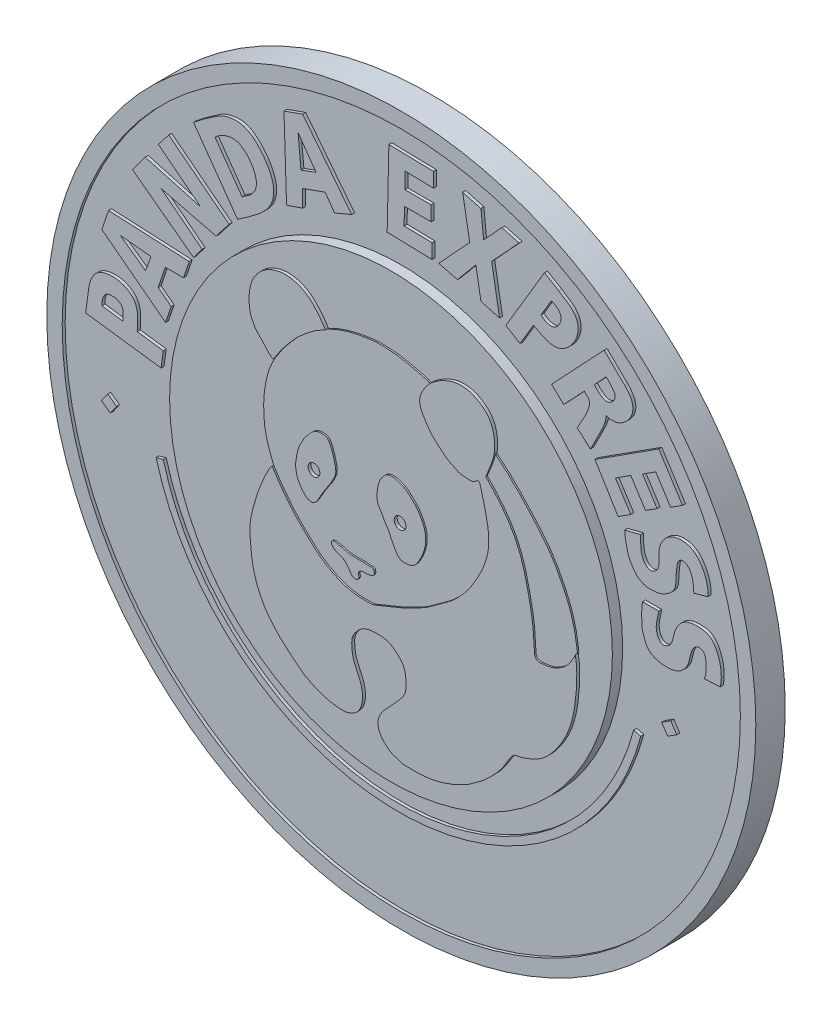
from build123d import *

# Parameters (mm, degrees)
SKETCH1_R             = 24.1
BOSS_EXTRUDE2_DEPTH   = 2
SKETCH1_5_R           = 23.05
CUT_EXTRUDE1_DEPTH    = 0.2
SKETCH1_6_R           = 15.05
BOSS_EXTRUDE3_DEPTH   = 0.7
BOSS_EXTRUDE4_START   = 0.7
BOSS_EXTRUDE4_DEPTH   = 0.2
BOSS_EXTRUDE5_START   = 0.7
BOSS_EXTRUDE5_DEPTH   = 0.1
BOSS_EXTRUDE6_REACH   = 36.141
BOSS_EXTRUDE7_START   = 0.7
SKETCH1_14_R          = 0.4
BOSS_EXTRUDE7_DEPTH   = 0.2
BOSS_EXTRUDE8_START   = 0.7
BOSS_EXTRUDE8_DEPTH   = 0.2
BOSS_EXTRUDE8_2_DEPTH = 0.2
BOSS_EXTRUDE9_DEPTH   = 0.2
BOSS_EXTRUDE11_START  = 0.7
BOSS_EXTRUDE11_DEPTH  = 0.1


with BuildPart() as part:
    # Sketch1 → Boss-Extrude2 (new body)
    with BuildSketch(Plane.XY):
        Circle(SKETCH1_R)
    extrude(amount=-BOSS_EXTRUDE2_DEPTH)

    # Sketch1<5> → Cut-Extrude1 (cut)
    with BuildSketch(Plane.XY):
        Circle(SKETCH1_5_R)
    extrude(amount=-CUT_EXTRUDE1_DEPTH, mode=Mode.SUBTRACT)

    # Sketch1<13> → Boss-Extrude6 (add, up to next)
    with BuildSketch(Plane.XY, mode=Mode.PRIVATE) as boss_extrude6_sk1:
        with BuildLine():
            Line((-21.454558101, 1.493044691), (-16.327953308, 0.809496286))
            Line((-16.327953308, 0.809496286), (-16.181251347, 1.909759225))
            Line((-16.181251347, 1.909759225), (-17.951073862, 2.14573594))
            add(Edge.make_bspline(
                [(-21.30785614, 2.59330763), (-21.269087053, 3.031695072), (-21.176750823, 3.698293171), (-20.549503717, 4.420348184), (-19.73147324, 4.602837812), (-18.826331516, 4.489218381), (-17.78761687, 3.716364728), (-17.916858964, 2.66450519), (-17.951073862, 2.14573594)],
                knots=[0, 0, 0, 0, 0.212608459, 0.302228017, 0.43529493, 0.58816005, 0.727720341, 1, 1, 1, 1], degree=3))
            Line((-21.30785614, 2.59330763), (-21.454558101, 1.493044691))
        make_face()
        with BuildLine():
            add(Edge.make_bspline(
                [(-20.356043735, 2.466399105), (-20.359571573, 2.708030583), (-20.308343626, 3.03611159), (-20.043729464, 3.322452659), (-19.844119656, 3.387377134), (-19.64292089, 3.395677377), (-19.431393119, 3.393138303), (-19.242122229, 3.331483053), (-19.085433999, 3.228302967), (-18.961451063, 3.09953306), (-18.902992442, 2.907938766), (-18.920909953, 2.629344337), (-18.93092145, 2.419013354), (-18.934625232, 2.276876333)],
                knots=[0, 0, 0, 0, 0.249669756, 0.316839939, 0.388223563, 0.457519881, 0.523446875, 0.604010027, 0.657002889, 0.715093793, 0.783365199, 0.854609936, 1, 1, 1, 1], degree=3))
            Line((-18.934625232, 2.276876333), (-20.356043735, 2.466399105))
        make_face(mode=Mode.SUBTRACT)
    boss_extrude6_tool1 = extrude(boss_extrude6_sk1.sketch, amount=-BOSS_EXTRUDE6_REACH, mode=Mode.PRIVATE) - part.part
    # Sketch1<13> → Boss-Extrude6 (add, up to next)
    with BuildSketch(Plane.XY, mode=Mode.PRIVATE) as boss_extrude6_sk2:
        Polygon((-20.356043735, 6.953181357), (-16.025692152, 3.644980448), (-15.640982502, 4.776069205), (-16.529105791, 5.454556901), (-16.041946435, 6.886859081), (-14.807058218, 6.886859081), (-14.415811635, 8.03716714), (-19.8974308, 8.301553917), align=None)
        Polygon((-17.015964835, 7.028954051), (-17.383164563, 6.012093265), (-19.092795457, 7.232326208), align=None, mode=Mode.SUBTRACT)
    boss_extrude6_tool2 = extrude(boss_extrude6_sk2.sketch, amount=-BOSS_EXTRUDE6_REACH, mode=Mode.PRIVATE) - part.part
    # Sketch1<13> → Boss-Extrude6 (add, up to next)
    with BuildSketch(Plane.XY, mode=Mode.PRIVATE) as boss_extrude6_sk3:
        Polygon((-18.273410657, 11.523825117), (-14.121881894, 8.418610449), (-13.536234385, 9.201594151), (-16.329125291, 11.379352737), (-12.595081245, 10.445425315), (-11.703462396, 11.5888919), (-15.807622037, 14.789113175), (-16.51476802, 13.882225884), (-13.643624714, 11.643449935), (-17.404920705, 12.684956119), align=None)
    boss_extrude6_tool3 = extrude(boss_extrude6_sk3.sketch, amount=-BOSS_EXTRUDE6_REACH, mode=Mode.PRIVATE) - part.part
    # Sketch1<13> → Boss-Extrude6 (add, up to next)
    with BuildSketch(Plane.XY, mode=Mode.PRIVATE) as boss_extrude6_sk4:
        with BuildLine():
            add(Edge.make_bspline(
                [(-14.121881894, 16.373486266), (-13.720947681, 16.720768365), (-13.088283438, 17.157147822), (-12.271029024, 17.730164282), (-11.5963487, 17.926670095), (-10.920510882, 17.950070557), (-10.259670343, 17.697217712), (-9.709817854, 17.204068973), (-9.228833293, 16.623852178), (-8.861986245, 15.96300137), (-8.646886812, 15.306443997), (-8.677787945, 14.659225873), (-8.863705619, 14.131896845), (-9.136189991, 13.741330795), (-9.416988277, 13.447686921), (-9.701917642, 13.193063443), (-10.03697698, 12.95342168), (-10.347164198, 12.69702854), (-10.732407419, 12.450883197), (-10.974322079, 12.26448262), (-11.129658038, 12.162396452)],
                knots=[0, 0, 0, 0, 0.13780552, 0.202860636, 0.258964816, 0.319387966, 0.376747243, 0.439137793, 0.510699252, 0.573297641, 0.636318727, 0.688639396, 0.739907564, 0.780606032, 0.812336217, 0.846157895, 0.880461424, 0.920110298, 0.951367896, 1, 1, 1, 1], degree=3))
            Line((-14.121881894, 16.373486266), (-11.129658038, 12.162396452))
        make_face()
        with BuildLine():
            Line((-10.817985001, 13.643953345), (-12.661193782, 16.237983102))
            add(Edge.make_bspline(
                [(-12.661193782, 16.237983102), (-12.456271193, 16.441703206), (-12.10840878, 16.647740732), (-11.593225221, 16.778301007), (-11.236327443, 16.763772443), (-10.892332608, 16.636617242), (-10.628141837, 16.414614136), (-10.380553609, 16.202506605), (-10.241945131, 15.957372388), (-10.079995548, 15.750565235), (-9.967254084, 15.499470869), (-9.871185441, 15.212188022), (-9.832617452, 14.894785877), (-9.883383951, 14.563241839), (-10.042437179, 14.269557858), (-10.338819756, 13.933714329), (-10.64843689, 13.789442812), (-10.817985001, 13.643953345)],
                knots=[0, 0, 0, 0, 0.150292122, 0.209994107, 0.278717341, 0.335693031, 0.40022503, 0.460062079, 0.506203541, 0.547788176, 0.598507712, 0.650560851, 0.707610478, 0.76587023, 0.82464374, 0.881692314, 1, 1, 1, 1], degree=3))
        make_face(mode=Mode.SUBTRACT)
    boss_extrude6_tool4 = extrude(boss_extrude6_sk4.sketch, amount=-BOSS_EXTRUDE6_REACH, mode=Mode.PRIVATE) - part.part
    # Sketch1<13> → Boss-Extrude6 (add, up to next)
    with BuildSketch(Plane.XY, mode=Mode.PRIVATE) as boss_extrude6_sk5:
        Polygon((-7.974177033, 20.120553353), (-7.799595489, 14.661213088), (-6.704425686, 15.033107611), (-6.704425686, 16.195602649), (-5.171959848, 16.740681464), (-4.539456119, 15.833570685), (-3.375266821, 16.323406298), (-6.704425686, 20.572187929), align=None)
        Polygon((-5.789851634, 17.599352034), (-6.819680156, 17.216832974), (-7.014782717, 19.322067757), align=None, mode=Mode.SUBTRACT)
    boss_extrude6_tool5 = extrude(boss_extrude6_sk5.sketch, amount=-BOSS_EXTRUDE6_REACH, mode=Mode.PRIVATE) - part.part
    # Sketch1<13> → Boss-Extrude6 (add, up to next)
    with BuildSketch(Plane.XY, mode=Mode.PRIVATE) as boss_extrude6_sk6:
        Polygon((2.195301165, 21.647297643), (-0.844142345, 21.71494863), (-0.960431122, 16.490292163), (0.179150517, 16.46492771), (2.096218153, 16.410498188), (2.096218153, 17.397777217), (0.190898665, 17.440185225), (0.216737425, 18.601076639), (2.035887167, 18.601076639), (2.035887167, 19.599010212), (0.238949119, 19.599010212), (0.263455739, 20.700050862), (2.195301165, 20.657052448), align=None)
    boss_extrude6_tool6 = extrude(boss_extrude6_sk6.sketch, amount=-BOSS_EXTRUDE6_REACH, mode=Mode.PRIVATE) - part.part
    # Sketch1<13> → Boss-Extrude6 (add, up to next)
    with BuildSketch(Plane.XY, mode=Mode.PRIVATE) as boss_extrude6_sk7:
        Polygon((4.649447881, 18.69066589), (2.543355999, 16.410498188), (3.820726789, 16.089749654), (5.069947102, 17.584156463), (5.415033097, 15.605933848), (6.679373265, 15.260251986), (6.14484022, 18.324489225), (8.006973776, 20.340534598), (6.837976125, 20.660148967), (5.594433593, 19.313823319), (5.415033097, 21.075695798), (4.174217834, 21.414945742), align=None)
    boss_extrude6_tool7 = extrude(boss_extrude6_sk7.sketch, amount=-BOSS_EXTRUDE6_REACH, mode=Mode.PRIVATE) - part.part
    # Sketch1<13> → Boss-Extrude6 (add, up to next)
    with BuildSketch(Plane.XY, mode=Mode.PRIVATE) as boss_extrude6_sk8:
        with BuildLine():
            Line((9.733221169, 19.453308849), (7.105074204, 15.033107611))
            Line((7.105074204, 15.033107611), (8.075145568, 14.456326154))
            Line((8.075145568, 14.456326154), (8.984364929, 15.985514818))
            add(Edge.make_bspline(
                [(10.703292533, 18.876527392), (10.976139706, 18.694667799), (11.446180549, 18.443382545), (11.958963168, 17.866223602), (12.08275078, 17.106824552), (11.787550295, 16.346594338), (11.282899643, 15.77149567), (10.69815773, 15.441745226), (10.117133066, 15.459247621), (9.547832459, 15.678724704), (9.200640706, 15.876878498), (8.984364929, 15.985514818)],
                knots=[0, 0, 0, 0, 0.155201782, 0.252118639, 0.353416679, 0.502545257, 0.622306325, 0.711777922, 0.810983913, 0.885242792, 1, 1, 1, 1], degree=3))
            Line((10.703292533, 18.876527392), (9.733221169, 19.453308849))
        make_face()
        with BuildLine():
            add(Edge.make_bspline(
                [(10.214900372, 18.055115323), (10.334141002, 17.985713254), (10.559193115, 17.889051769), (10.821348771, 17.611659925), (10.895633316, 17.244656748), (10.74853728, 16.925660235), (10.577309017, 16.673956253), (10.328554046, 16.537429151), (10.066512482, 16.548579526), (9.772266815, 16.622544827), (9.600470082, 16.769224415), (9.49514548, 16.844581245)],
                knots=[0, 0, 0, 0, 0.142608005, 0.248614645, 0.381600388, 0.498063407, 0.601039836, 0.69182726, 0.774831317, 0.865222053, 1, 1, 1, 1], degree=3))
            Line((9.49514548, 16.844581245), (10.214900372, 18.055115323))
        make_face(mode=Mode.SUBTRACT)
    boss_extrude6_tool8 = extrude(boss_extrude6_sk8.sketch, amount=-BOSS_EXTRUDE6_REACH, mode=Mode.PRIVATE) - part.part
    # Sketch1<13> → Boss-Extrude6 (add, up to next)
    with BuildSketch(Plane.XY, mode=Mode.PRIVATE) as boss_extrude6_sk9:
        with BuildLine():
            Line((13.785876372, 16.919250224), (10.214900372, 13.127968687))
            Line((10.214900372, 13.127968687), (11.040771467, 12.35008769))
            Line((11.040771467, 12.35008769), (12.438839547, 13.834407298))
            add(Edge.make_bspline(
                [(11.959059548, 11.440428083), (12.107128019, 11.682258756), (12.30776272, 12.074248006), (12.588152852, 12.572013181), (12.725418494, 12.939007261), (12.822889946, 13.25147206), (12.74028752, 13.600294741), (12.522003211, 13.723407828), (12.438839547, 13.834407298)],
                knots=[0.001998643, 0.001998643, 0.001998643, 0.001998643, 0.314515855, 0.488901301, 0.630485924, 0.747957538, 0.844440069, 1, 1, 1, 1], degree=3))
            ThreePointArc((11.959059548, 11.440428083), (11.981807973, 11.416600969), (12.004508925, 11.392728623))
            Line((12.004508925, 11.392728623), (12.856922609, 10.632659162))
            add(Edge.make_bspline(
                [(13.922823316, 13.136343227), (13.912893589, 13.043386911), (13.897721496, 12.831399893), (13.744629741, 12.382560594), (13.370887061, 11.653941356), (13.070869808, 11.019781168), (12.856922609, 10.632659162)],
                knots=[0, 0, 0, 0, 0.102574853, 0.231519659, 0.515580193, 1, 1, 1, 1], degree=3))
            add(Edge.make_bspline(
                [(15.187701822, 15.555747589), (15.406639722, 15.345551135), (15.76679187, 14.899891184), (15.752431175, 14.04989143), (15.330933333, 13.462407312), (14.701147714, 13.037260168), (14.180357027, 13.036367258), (13.922823316, 13.136343227)],
                knots=[0, 0, 0, 0, 0.242155248, 0.419874557, 0.622755476, 0.783720355, 1, 1, 1, 1], degree=3))
            Line((15.187701822, 15.555747589), (13.785876372, 16.919250224))
        make_face()
        with BuildLine():
            add(Edge.make_bspline(
                [(13.129910352, 14.570527447), (13.230255787, 14.411221349), (13.453383267, 14.220480206), (13.795268778, 13.97188937), (14.131492861, 13.991365737), (14.354434181, 14.169747184), (14.510978067, 14.375741798), (14.580202902, 14.667886564), (14.307829888, 15.023418863), (14.116130131, 15.266008124), (13.922823316, 15.42100288)],
                knots=[0, 0, 0, 0, 0.184547941, 0.297295251, 0.411883371, 0.489672423, 0.576661881, 0.671430096, 0.761868293, 1, 1, 1, 1], degree=3))
            Line((13.129910352, 14.570527447), (13.922823316, 15.42100288))
        make_face(mode=Mode.SUBTRACT)
    boss_extrude6_tool9 = extrude(boss_extrude6_sk9.sketch, amount=-BOSS_EXTRUDE6_REACH, mode=Mode.PRIVATE) - part.part
    # Sketch1<13> → Boss-Extrude6 (add, up to next)
    with BuildSketch(Plane.XY, mode=Mode.PRIVATE) as boss_extrude6_sk10:
        Polygon((17.504071088, 12.961911592), (13.163013963, 10.17704942), (14.740942737, 7.604645708), (15.600776909, 8.156243992), (14.558557318, 9.780861119), (15.600776909, 10.449462759), (16.600193152, 8.891567706), (17.390228445, 9.398388818), (16.402559441, 10.937972218), (17.296867181, 11.511685883), (18.309960473, 9.932470977), (19.115849857, 10.449462759), align=None)
    boss_extrude6_tool10 = extrude(boss_extrude6_sk10.sketch, amount=-BOSS_EXTRUDE6_REACH, mode=Mode.PRIVATE) - part.part
    # Sketch1<13> → Boss-Extrude6 (add, up to next)
    with BuildSketch(Plane.XY, mode=Mode.PRIVATE) as boss_extrude6_sk11:
        with BuildLine():
            add(Edge.make_bspline(
                [(19.890690399, 5.662673932), (19.853790369, 5.830677719), (19.872803171, 6.183143415), (19.743010968, 6.673498646), (19.527725108, 7.069657107), (19.198617195, 7.217484687), (18.89346543, 7.155709304), (18.747406461, 6.845046184), (18.718506168, 6.502472609), (18.674894799, 6.110402386), (18.66882323, 5.745378889), (18.642066646, 5.427901212), (18.505655603, 5.073135788), (18.19290922, 4.800844306), (17.787109606, 4.557259853), (17.374759034, 4.427302478), (16.997475702, 4.43572184), (16.650424367, 4.418146769), (16.314475307, 4.546390555), (15.927450556, 4.792393913), (15.762270862, 5.087213547), (15.662181863, 5.234978413)],
                knots=[0, 0, 0, 0, 0.068423794, 0.138793531, 0.202186499, 0.239054421, 0.276469421, 0.312497573, 0.365649448, 0.4152575, 0.46943199, 0.511705126, 0.541627686, 0.618953929, 0.670053954, 0.731472513, 0.78778593, 0.820419111, 0.869001571, 0.928329828, 1, 1, 1, 1], degree=3))
            Line((19.890690399, 5.662673932), (20.841989759, 5.931296551))
            add(Edge.make_bspline(
                [(16.27472163, 7.308845371), (16.277909194, 6.947137675), (16.239486919, 6.406579053), (16.487808699, 5.815005412), (16.799261451, 5.500870574), (17.229323459, 5.570008768), (17.564066749, 6.001092736), (17.463650423, 6.672005981), (17.575095445, 7.421690172), (18.031665487, 8.083750344), (18.851699685, 8.459282857), (19.879550771, 8.270235018), (20.649531032, 7.297334254), (20.887637032, 6.455758914), (20.841989759, 5.931296551)],
                knots=[0, 0, 0, 0, 0.118465434, 0.166211117, 0.204261369, 0.250625979, 0.284913995, 0.370065441, 0.453976586, 0.525646908, 0.618545798, 0.728728758, 0.83223062, 1, 1, 1, 1], degree=3))
            Line((16.27472163, 7.308845371), (15.187701822, 7.028954051))
            add(Edge.make_bspline(
                [(15.662181863, 5.234978413), (15.491735816, 5.464379161), (15.322165524, 6.073199127), (15.196507036, 6.68228281), (15.187701822, 7.028954051)],
                knots=[0, 0, 0, 0, 0.449772335, 1, 1, 1, 1], degree=3))
        make_face()
    boss_extrude6_tool11 = extrude(boss_extrude6_sk11.sketch, amount=-BOSS_EXTRUDE6_REACH, mode=Mode.PRIVATE) - part.part
    # Sketch1<13> → Boss-Extrude6 (add, up to next)
    with BuildSketch(Plane.XY, mode=Mode.PRIVATE) as boss_extrude6_sk12:
        with BuildLine():
            Line((20.606261425, 0.98525871), (21.680437171, 1.042063585))
            add(Edge.make_bspline(
                [(17.504071088, 3.417364261), (17.415268685, 2.941493375), (17.138004607, 2.244238494), (17.740652306, 1.462683114), (18.355458696, 1.785642154), (18.490996779, 2.370600314), (18.651713853, 3.062520369), (19.218607234, 3.765159346), (20.096813609, 3.879198963), (21.147124761, 3.744450938), (21.765007945, 2.485289327), (21.788457739, 1.534805634), (21.680437171, 1.042063585)],
                knots=[0, 0, 0, 0, 0.166112758, 0.213940837, 0.272936366, 0.341539756, 0.406059603, 0.505933127, 0.610915937, 0.681572606, 0.837608598, 1, 1, 1, 1], degree=3))
            Line((17.504071088, 3.417364261), (16.402559441, 3.417364261))
            add(Edge.make_bspline(
                [(20.606261425, 0.98525871), (20.73169735, 1.325880306), (20.742627728, 1.812503939), (20.661348206, 2.553634122), (20.133310213, 2.706003584), (19.761436221, 2.33296423), (19.626540345, 1.818132718), (19.505166339, 1.156931227), (18.908594015, 0.449901546), (17.839916079, 0.325277612), (16.792137215, 0.619410237), (16.507969162, 1.340953475), (16.353770638, 1.835350138), (16.341725908, 2.514616521), (16.32412956, 3.039822168), (16.402559441, 3.417364261)],
                knots=[0, 0, 0, 0, 0.111139183, 0.169017983, 0.211891193, 0.254869061, 0.321101138, 0.382253519, 0.469555963, 0.595041921, 0.710524176, 0.783644283, 0.830558092, 0.877500043, 1, 1, 1, 1], degree=3))
        make_face()
    boss_extrude6_tool12 = extrude(boss_extrude6_sk12.sketch, amount=-BOSS_EXTRUDE6_REACH, mode=Mode.PRIVATE) - part.part
    add(boss_extrude6_tool1.solids().sort_by_distance((-19.36834, 4.473319, 0))[0])
    add(boss_extrude6_tool2.solids().sort_by_distance((-18.145047, 5.35906, 0))[0])
    add(boss_extrude6_tool3.solids().sort_by_distance((-14.989116, 11.616085, 0))[0])
    add(boss_extrude6_tool4.solids().sort_by_distance((-9.364938, 16.638095, 0))[0])
    add(boss_extrude6_tool5.solids().sort_by_distance((-5.098798, 18.401605, 0))[0])
    add(boss_extrude6_tool6.solids().sort_by_distance((0.395258, 19.082265, 0))[0])
    add(boss_extrude6_tool7.solids().sort_by_distance((5.343603, 18.317095, 0))[0])
    add(boss_extrude6_tool8.solids().sort_by_distance((8.479396, 17.207386, 0))[0])
    add(boss_extrude6_tool9.solids().sort_by_distance((13.242281, 13.983077, 0))[0])
    add(boss_extrude6_tool10.solids().sort_by_distance((16.015231, 10.484764, 0))[0])
    add(boss_extrude6_tool11.solids().sort_by_distance((18.004787, 6.385287, 0))[0])
    add(boss_extrude6_tool12.solids().sort_by_distance((18.987507, 2.127619, 0))[0])


with BuildPart() as body_2:
    # Sketch1<6> → Boss-Extrude3 (new body)
    with BuildSketch(Plane.XY):
        Circle(SKETCH1_6_R)
    extrude(amount=BOSS_EXTRUDE3_DEPTH)

    # Sketch1<9> → Boss-Extrude4 (add)
    with BuildSketch(Plane.XY.offset(BOSS_EXTRUDE4_START)):
        with BuildLine():
            add(Edge.make_bspline(
                [(6.818969463, 2.276876333), (6.818972535, 2.016075745), (6.709228868, 1.62278693), (6.507134137, 0.9990057), (6.254606007, 0.40264171), (5.914456505, -0.176152608), (5.465500809, -0.929532707), (4.886307669, -1.597880892), (4.114495604, -2.310058013), (3.361495275, -2.783785529), (2.630673105, -3.39600376), (1.817266904, -3.786029324), (1.001171508, -4.214969966), (0.212549856, -4.521018474), (-0.480104679, -4.799838373), (-0.967044049, -5.031403897), (-1.495379732, -5.042753591), (-2.15106962, -5.037624468), (-2.98519958, -4.868085289), (-3.785857236, -4.515645626), (-4.659078858, -3.99151676), (-5.540446133, -3.181512443), (-6.753440466, -1.975214962), (-7.455833665, -0.950999468), (-7.869809843, -0.296566507)],
                knots=[0, 0, 0, 0, 0.038566194, 0.060844474, 0.098257162, 0.135205538, 0.161302624, 0.229507883, 0.266608799, 0.318217716, 0.36234321, 0.408696061, 0.452572294, 0.500531837, 0.534926378, 0.565085715, 0.579479258, 0.613415868, 0.663456945, 0.705415488, 0.743957972, 0.815443198, 0.883790701, 1, 1, 1, 1], degree=3))
            add(Edge.make_bspline(
                [(-7.869809843, -0.296566507), (-7.96693336, -0.372014181), (-8.109345389, -0.587334092), (-8.368630656, -1.105632885), (-8.608995781, -1.681388179), (-8.866773342, -2.324756189), (-9.041672373, -2.94810207), (-9.264034553, -3.69560297), (-9.429811016, -4.59339859), (-9.361348333, -5.40908465), (-9.305285396, -6.145642159), (-9.193145665, -6.856364856), (-8.933732448, -7.821561085), (-8.366426551, -8.977532549), (-7.486370073, -10.016638224), (-6.568849997, -10.786324373), (-5.860312094, -11.388648208), (-5.179287136, -11.762668641), (-4.366966976, -12.108512115), (-3.585849678, -12.256373041), (-2.861543491, -12.278869847), (-2.446518368, -12.125529062), (-1.899914435, -11.765648965), (-1.686984937, -10.997120092), (-1.782805769, -10.20133034), (-2.056604695, -9.552124894), (-2.390726829, -8.920188814), (-2.465937515, -8.278207727), (-2.47937426, -7.762339288), (-2.301091218, -7.316613939), (-2.039001195, -7.048639368), (-1.747800459, -6.769897176), (-1.495034505, -6.68451312), (-1.171525354, -6.596900529), (-0.871403942, -6.588055657), (-0.514332642, -6.575400037), (-0.140888911, -6.630386954), (0.289142859, -6.793561389), (0.705850095, -7.143298307), (1.131004712, -7.608638962), (1.225006682, -8.248766372), (1.246569098, -8.812280912), (1.115190683, -9.330311107), (0.832490151, -9.642238844), (0.440972041, -10.105812288), (-0.006007995, -10.538568682), (-0.467312942, -11.09014879), (-0.71050276, -11.588384546), (-0.684492305, -12.01784728), (-0.558132551, -12.34425311), (-0.409481023, -12.601713346), (-0.12021847, -12.882790544), (0.227916628, -13.162127997), (0.621818629, -13.238851668), (0.929061436, -13.37227928), (1.20918678, -13.406629172), (1.553263665, -13.395151743), (1.939934804, -13.402982554), (2.373253128, -13.390703632), (2.833069631, -13.337939364), (3.297532351, -13.24604843), (3.73668003, -13.126378731), (4.156384423, -12.982562084), (4.542001468, -12.840256541), (4.996730831, -12.588173204), (5.407323353, -12.417414861), (5.695573087, -12.181739786), (5.927906963, -12.0253303), (6.320617925, -11.752128083), (7.047991759, -11.099872917), (7.830358725, -10.255212084), (8.24950332, -9.412248184), (8.557499518, -9.066228209), (8.791409505, -9.009831955), (9.114079595, -8.967937256), (9.478043588, -8.828525273), (9.923653264, -8.646481464), (10.351959642, -8.418317541), (10.893980695, -7.972095154), (11.467979186, -7.287484726), (11.99272887, -6.440729962), (12.549713697, -5.160621919), (12.828527823, -3.371947699), (12.868581189, -1.857165343), (12.729763258, -1.088308269)],
                knots=[0, 0, 0, 0, 0.007010537, 0.014782634, 0.033549254, 0.043070835, 0.05485343, 0.070952387, 0.088247815, 0.107232127, 0.118017028, 0.131016221, 0.14878726, 0.175673601, 0.204759725, 0.226791646, 0.244991574, 0.258357052, 0.27156497, 0.295939949, 0.303925945, 0.313058282, 0.321071027, 0.341004368, 0.354331635, 0.367388279, 0.381473586, 0.395308708, 0.4043606, 0.410961498, 0.422436904, 0.425735385, 0.434170083, 0.437335549, 0.445159935, 0.451379686, 0.458007084, 0.46687657, 0.477543294, 0.489340397, 0.502234961, 0.513643921, 0.52212255, 0.532268073, 0.537492484, 0.557325905, 0.568111668, 0.579108167, 0.588450375, 0.591926077, 0.599359756, 0.605375376, 0.615249554, 0.624545795, 0.628147572, 0.634579709, 0.640610294, 0.648095985, 0.656937275, 0.665670523, 0.674835867, 0.684304981, 0.691971774, 0.700513775, 0.708012379, 0.722053725, 0.725913079, 0.729489119, 0.738257404, 0.753547794, 0.786033268, 0.803682868, 0.808277166, 0.811876796, 0.817215013, 0.827205499, 0.834170613, 0.845129249, 0.855095183, 0.874602654, 0.896509086, 0.91253916, 0.955058075, 1, 1, 1, 1], degree=3))
            add(Edge.make_bspline(
                [(12.729763258, -1.088308269), (12.679687119, -1.223133743), (12.559977817, -1.442577704), (12.2508316, -1.965717058), (11.726647969, -2.39295794), (11.036274631, -2.695812567), (10.58258551, -2.731835361), (10.24227175, -2.77062474), (10.07378951, -2.671457134), (9.940739677, -2.531879687), (9.966041596, -2.379627041), (9.945643676, -2.245280186), (9.942629733, -2.079834109), (9.926097817, -1.866491222), (9.896791012, -1.478478243), (9.874069732, -1.069326465), (9.772236154, -0.193332352), (9.53581977, 0.969114022), (9.18730645, 2.484351703), (8.647645721, 3.807758978), (7.971813501, 4.857931097), (7.480171154, 5.452347811), (7.219393578, 5.742957999), (7.175829817, 5.798889415), (7.127899295, 5.851066336), (7.016993813, 5.970922477), (6.895008708, 6.072531854), (6.762371688, 6.230794468), (6.63532864, 6.343628034), (6.785030144, 6.695760177), (6.994712019, 7.188104146), (7.269015328, 7.99357048), (7.257310635, 8.964242896), (6.965018869, 9.943797549), (6.169923755, 10.597086723), (5.329200802, 10.922847079), (4.49497624, 10.871738277), (3.822343738, 10.618895789), (3.234246775, 10.272920649), (2.88146567, 9.991577039), (2.742046095, 9.812414632)],
                knots=[0, 0, 0, 0, 0.034675226, 0.060301084, 0.146524717, 0.192051636, 0.240064034, 0.257137759, 0.271971198, 0.286029499, 0.30016408, 0.306562889, 0.318999333, 0.339993274, 0.358310682, 0.413001363, 0.438972772, 0.571315454, 0.699318335, 0.814210442, 0.914445333, 1, 1, 1.009021504, 1.017162217, 1.017162217, 1.04857665, 1.063495067, 1.073539847, 1.090588747, 1.152145784, 1.230823429, 1.312270465, 1.413385911, 1.493664826, 1.581349401, 1.65093146, 1.713991654, 1.773851447, 1.834799599, 1.834799599, 1.834799599, 1.834799599], degree=3))
            add(Edge.make_bspline(
                [(2.742046095, 9.812414632), (2.739437682, 9.808403826), (2.724192136, 9.794760185), (2.689835188, 9.766944302), (2.647566543, 9.712351751), (2.603025291, 9.639770644), (2.537730312, 9.574448178), (2.495268772, 9.482611118), (2.425365112, 9.397256245), (2.377593465, 9.289495348), (2.305939073, 9.178872539), (2.253434855, 9.043448982), (2.188743261, 8.894412191), (2.153802979, 8.732045742), (2.143540801, 8.547813821), (2.178295922, 8.313729894), (2.263919796, 8.029434922), (2.436206257, 7.740309694), (2.628681105, 7.448621279), (2.82855084, 7.151351116), (3.077894194, 6.885223153), (3.354841886, 6.606996047), (3.690034235, 6.321331947), (4.071439599, 6.04723914), (4.481015801, 5.829791799), (4.913018458, 5.622687138), (5.399277401, 5.619311654), (5.838009597, 5.569780126), (6.096630615, 5.904992499), (6.243495731, 5.768816388), (6.269996624, 5.657996317), (6.321817154, 5.507145466), (6.360482505, 5.33356923), (6.474476456, 4.993128661), (6.529059062, 4.638280763), (6.648762378, 4.17395182), (6.814066804, 3.444447359), (6.879163358, 2.758796708), (6.818969463, 2.276876333)],
                knots=[0.003218956, 0.003218956, 0.003218956, 0.003218956, 0.00478284, 0.008507585, 0.016208615, 0.023904003, 0.032742353, 0.042051008, 0.052290711, 0.063812512, 0.075278652, 0.089559319, 0.104862671, 0.12129973, 0.136340641, 0.156964908, 0.188092238, 0.219870604, 0.251904477, 0.287378777, 0.32118408, 0.355102521, 0.398707426, 0.445984599, 0.487791774, 0.530607296, 0.579554313, 0.623785596, 0.65480304, 0.659486549, 0.677018842, 0.686171496, 0.704890868, 0.727286901, 0.787897155, 0.806238938, 0.863281898, 1, 1, 1, 1], degree=3))
        make_face()
        with BuildLine():
            add(Edge.make_bspline(
                [(-7.799595489, 6.046404856), (-8.114158624, 6.193415943), (-8.406118877, 6.691651463), (-8.968425683, 7.113416624), (-9.186776915, 7.551577331), (-9.350608002, 7.887312468), (-9.434712394, 8.336334103), (-9.467641687, 8.946110041), (-9.381324966, 9.67392292), (-9.025377344, 10.419675717), (-8.457377158, 11.018087889), (-7.663506604, 11.392808448), (-6.609752272, 11.510140061), (-5.489886909, 11.087928555), (-4.75561822, 10.264754253), (-4.381942449, 9.767802785), (-4.267407551, 9.536107619)],
                knots=[0, 0, 0, 0, 0.091044617, 0.156662025, 0.189318949, 0.225208357, 0.259758503, 0.314672972, 0.394281024, 0.459416133, 0.540292261, 0.617479226, 0.697592881, 0.828696275, 0.928545323, 1, 1, 1, 1], degree=3))
            add(Edge.make_bspline(
                [(-7.799595489, 6.046404856), (-7.645063487, 6.266532448), (-7.420378791, 6.654467881), (-7.046480658, 7.153747205), (-6.680402881, 7.586584965), (-6.309852925, 8.022325736), (-5.865908425, 8.44969153), (-5.386666011, 8.825043485), (-4.897139972, 9.213099523), (-4.504854879, 9.41325211), (-4.298582942, 9.520025626), (-4.267407551, 9.536107619)],
                knots=[0, 0, 0, 0, 0.080974608, 0.1347776, 0.187605273, 0.251730483, 0.306954445, 0.37279618, 0.435137119, 0.49445864, 0.505015537, 0.505015537, 0.505015537, 0.505015537], degree=3))
        make_face()
    extrude(amount=BOSS_EXTRUDE4_DEPTH)

    # Sketch1<10> → Boss-Extrude5 (add)
    with BuildSketch(Plane.XY.offset(BOSS_EXTRUDE5_START)):
        with BuildLine():
            add(Edge.make_bspline(
                [(-7.869809843, -0.296566507), (-8.09538098, 0.230139778), (-8.449162866, 1.174273805), (-8.5702629, 2.546657728), (-8.551524009, 3.609311984), (-8.383486661, 4.488029783), (-8.192917591, 5.286454777), (-7.929661769, 5.779042781), (-7.799595489, 6.046404856)],
                knots=[0, 0, 0, 0, 0.262924328, 0.455257572, 0.626554903, 0.746828109, 0.863806758, 1, 1, 1, 1], degree=3))
            add(Edge.make_bspline(
                [(6.818969463, 2.276876333), (6.818972535, 2.016075745), (6.709228868, 1.62278693), (6.507134137, 0.9990057), (6.254606007, 0.40264171), (5.914456505, -0.176152608), (5.465500809, -0.929532707), (4.886307669, -1.597880892), (4.114495604, -2.310058013), (3.361495275, -2.783785529), (2.630673105, -3.39600376), (1.817266904, -3.786029324), (1.001171508, -4.214969966), (0.212549856, -4.521018474), (-0.480104679, -4.799838373), (-0.967044049, -5.031403897), (-1.495379732, -5.042753591), (-2.15106962, -5.037624468), (-2.98519958, -4.868085289), (-3.785857236, -4.515645626), (-4.659078858, -3.99151676), (-5.540446133, -3.181512443), (-6.753440466, -1.975214962), (-7.455833665, -0.950999468), (-7.869809843, -0.296566507)],
                knots=[0, 0, 0, 0, 0.038566194, 0.060844474, 0.098257162, 0.135205538, 0.161302624, 0.229507883, 0.266608799, 0.318217716, 0.36234321, 0.408696061, 0.452572294, 0.500531837, 0.534926378, 0.565085715, 0.579479258, 0.613415868, 0.663456945, 0.705415488, 0.743957972, 0.815443198, 0.883790701, 1, 1, 1, 1], degree=3))
            add(Edge.make_bspline(
                [(2.742046095, 9.812414632), (2.739437682, 9.808403826), (2.724192136, 9.794760185), (2.689835188, 9.766944302), (2.647566543, 9.712351751), (2.603025291, 9.639770644), (2.537730312, 9.574448178), (2.495268772, 9.482611118), (2.425365112, 9.397256245), (2.377593465, 9.289495348), (2.305939073, 9.178872539), (2.253434855, 9.043448982), (2.188743261, 8.894412191), (2.153802979, 8.732045742), (2.143540801, 8.547813821), (2.178295922, 8.313729894), (2.263919796, 8.029434922), (2.436206257, 7.740309694), (2.628681105, 7.448621279), (2.82855084, 7.151351116), (3.077894194, 6.885223153), (3.354841886, 6.606996047), (3.690034235, 6.321331947), (4.071439599, 6.04723914), (4.481015801, 5.829791799), (4.913018458, 5.622687138), (5.399277401, 5.619311654), (5.838009597, 5.569780126), (6.096630615, 5.904992499), (6.243495731, 5.768816388), (6.269996624, 5.657996317), (6.321817154, 5.507145466), (6.360482505, 5.33356923), (6.474476456, 4.993128661), (6.529059062, 4.638280763), (6.648762378, 4.17395182), (6.814066804, 3.444447359), (6.879163358, 2.758796708), (6.818969463, 2.276876333)],
                knots=[0.003218956, 0.003218956, 0.003218956, 0.003218956, 0.00478284, 0.008507585, 0.016208615, 0.023904003, 0.032742353, 0.042051008, 0.052290711, 0.063812512, 0.075278652, 0.089559319, 0.104862671, 0.12129973, 0.136340641, 0.156964908, 0.188092238, 0.219870604, 0.251904477, 0.287378777, 0.32118408, 0.355102521, 0.398707426, 0.445984599, 0.487791774, 0.530607296, 0.579554313, 0.623785596, 0.65480304, 0.659486549, 0.677018842, 0.686171496, 0.704890868, 0.727286901, 0.787897155, 0.806238938, 0.863281898, 1, 1, 1, 1], degree=3))
            add(Edge.make_bspline(
                [(2.716480936, 9.834904901), (2.744735177, 9.828825134), (2.747415016, 9.820670112), (2.742046095, 9.812414632)],
                knots=[0, 0, 0, 0, 0.003218956, 0.003218956, 0.003218956, 0.003218956], degree=3))
            add(Edge.make_bspline(
                [(0.516973723, 10.391006724), (0.757088239, 10.362977739), (1.130136679, 10.287779363), (1.685072009, 10.172275109), (2.180465103, 10.024394012), (2.55444729, 9.948668933), (2.716480936, 9.834904901)],
                knots=[0, 0, 0, 0, 0.318288353, 0.501169211, 0.746277873, 1, 1, 1, 1], degree=3))
            add(Edge.make_bspline(
                [(-4.267407551, 9.536107619), (-4.150077966, 9.596632719), (-3.839689728, 9.754673706), (-3.273409477, 9.975074748), (-2.543747845, 10.198367271), (-1.755798481, 10.349903346), (-0.727198713, 10.503297059), (0.027961111, 10.418775209), (0.516973723, 10.391006724)],
                knots=[0.505015537, 0.505015537, 0.505015537, 0.505015537, 0.544746761, 0.609959749, 0.687673458, 0.774237852, 0.851502193, 1, 1, 1, 1], degree=3))
            add(Edge.make_bspline(
                [(-7.799595489, 6.046404856), (-7.645063487, 6.266532448), (-7.420378791, 6.654467881), (-7.046480658, 7.153747205), (-6.680402881, 7.586584965), (-6.309852925, 8.022325736), (-5.865908425, 8.44969153), (-5.386666011, 8.825043485), (-4.897139972, 9.213099523), (-4.504854879, 9.41325211), (-4.298582942, 9.520025626), (-4.267407551, 9.536107619)],
                knots=[0, 0, 0, 0, 0.080974608, 0.1347776, 0.187605273, 0.251730483, 0.306954445, 0.37279618, 0.435137119, 0.49445864, 0.505015537, 0.505015537, 0.505015537, 0.505015537], degree=3))
        make_face()
        with BuildLine():
            add(Edge.make_bspline(
                [(-3.844227289, -2.837577595), (-3.857078509, -2.796844996), (-3.864701863, -2.69655737), (-3.754991406, -2.605325221), (-3.580211294, -2.582928195), (-3.379064381, -2.681698795), (-3.138263886, -2.680460245), (-2.861108537, -2.779595557), (-2.521924983, -2.841103315), (-2.075388665, -2.849926609), (-1.596471741, -2.832591524), (-1.255798782, -2.872818937), (-0.961320139, -2.879227894), (-0.942450865, -2.995851159), (-0.927619555, -3.112256227), (-0.957407192, -3.291144795), (-1.195395779, -3.370021819), (-1.441956694, -3.433601681), (-1.716713274, -3.382484255), (-1.918471128, -3.473059832), (-2.04269962, -3.6436311), (-1.959093755, -3.830424606), (-2.016099144, -4.034521437), (-2.194368675, -4.111933756), (-2.430878436, -4.084737617), (-2.562136992, -3.844136626), (-2.733157571, -3.629205811), (-2.912802027, -3.410987197), (-3.162123426, -3.227593769), (-3.44175028, -3.185785693), (-3.675904192, -3.060764885), (-3.804909092, -2.93728084), (-3.840152498, -2.850492854), (-3.844227289, -2.837577595)],
                knots=[0, 0, 0, 0, 0.017312159, 0.037390626, 0.051205606, 0.088305757, 0.125243307, 0.148544408, 0.208576885, 0.265756121, 0.332971658, 0.400272207, 0.421139712, 0.433789647, 0.442819788, 0.471285661, 0.497084509, 0.537673577, 0.577475984, 0.607463187, 0.623843191, 0.658288921, 0.682486595, 0.701901093, 0.733310205, 0.770198136, 0.806364928, 0.848099139, 0.885785679, 0.930359415, 0.961400295, 0.99451076, 1, 1, 1, 1], degree=3))
        make_face(mode=Mode.SUBTRACT)
        with BuildLine():
            add(Edge.make_bspline(
                [(-5.05932588, -1.035098293), (-5.148755143, -1.083969534), (-5.29603628, -1.051474735), (-5.484268435, -1.001885688), (-5.658261113, -0.867973785), (-5.836992193, -0.66899922), (-6.065860403, -0.34549912), (-6.220974106, 0.055485512), (-6.305396591, 0.529490516), (-6.244019403, 1.014571669), (-6.149442829, 1.499885184), (-6.016499128, 1.894334644), (-5.895539719, 2.089365367), (-5.853130649, 2.14573594)],
                knots=[0, 0, 0, 0, 0.072527691, 0.112402371, 0.148381663, 0.238595901, 0.317745503, 0.451456365, 0.565272368, 0.683898349, 0.823832116, 0.946186659, 1, 1, 1, 1], degree=3))
            add(Edge.make_bspline(
                [(-5.853130649, 2.14573594), (-5.813670594, 2.198186653), (-5.777808891, 2.375459502), (-5.577784902, 2.590437143), (-5.374373087, 2.876323237), (-5.09238618, 3.138575063), (-4.747960933, 3.34331165), (-4.424635259, 3.310503935), (-4.162208316, 3.302119169), (-4.016075364, 3.110648824), (-3.848828241, 2.799519339), (-3.700092485, 2.348671377), (-3.566209004, 1.831230633), (-3.530934464, 1.40664495), (-3.702531933, 1.068328304), (-3.820203168, 0.798532867), (-4.063835366, 0.468528896), (-4.301795129, 0.0852607), (-4.646332763, -0.456063177), (-4.825261135, -0.882897607), (-5.05932588, -1.035098293)],
                knots=[0, 0, 0, 0, 0.02721362, 0.073862877, 0.120798178, 0.175727514, 0.237147471, 0.280266855, 0.312443784, 0.341415739, 0.375149899, 0.464016313, 0.538849917, 0.604009827, 0.635554076, 0.697288553, 0.728277525, 0.808416763, 0.887940314, 1, 1, 1, 1], degree=3))
        make_face(mode=Mode.SUBTRACT)
        with BuildLine():
            add(Edge.make_bspline(
                [(-0.745534099, 1.416662809), (-0.751799321, 1.507859454), (-0.760540632, 1.691510353), (-0.700498396, 2.048847544), (-0.621350055, 2.448035956), (-0.383825746, 2.845285776), (-0.083536142, 3.14702515), (0.383607996, 3.210733576), (0.812760795, 3.076056694), (1.248725997, 2.873619385), (1.579607666, 2.543641286), (1.960925654, 2.191125671), (2.265450313, 1.702044093), (2.556533877, 1.076170205), (2.59384819, 0.357317462), (2.386832406, -0.333310464), (2.131910304, -0.856004999), (1.811161813, -1.342922516), (1.319973062, -1.500243526), (0.779605596, -1.479852042), (0.492503929, -1.031204136), (0.240438976, -0.602494939), (0.057715946, -0.105652118), (-0.275566435, 0.3042629), (-0.437984445, 0.73060366), (-0.713770568, 1.052362067), (-0.736677759, 1.28774981), (-0.745534099, 1.416662809)],
                knots=[0, 0, 0, 0, 0.021935651, 0.044949898, 0.087915512, 0.119709184, 0.157130632, 0.186448548, 0.229202405, 0.265310366, 0.302252296, 0.341943439, 0.391483606, 0.441272618, 0.50886181, 0.560752837, 0.615140832, 0.651568167, 0.697768906, 0.734975088, 0.772439315, 0.817526707, 0.858960144, 0.899430482, 0.944730808, 0.968992384, 1, 1, 1, 1], degree=3))
        make_face(mode=Mode.SUBTRACT)
    extrude(amount=BOSS_EXTRUDE5_DEPTH)

    # Sketch1<14> → Boss-Extrude7 (add)
    # profile 1 of 3: a face of its own
    with BuildSketch(Plane.XY.offset(BOSS_EXTRUDE7_START)):
        with BuildLine():
            add(Edge.make_bspline(
                [(-5.05932588, -1.035098293), (-4.825261135, -0.882897607), (-4.646332763, -0.456063177), (-4.301795129, 0.0852607), (-4.063835366, 0.468528896), (-3.820203168, 0.798532867), (-3.702531933, 1.068328304), (-3.530934464, 1.40664495), (-3.566209004, 1.831230633), (-3.700092485, 2.348671377), (-3.848828241, 2.799519339), (-4.016075364, 3.110648824), (-4.162208316, 3.302119169), (-4.424635259, 3.310503935), (-4.747960933, 3.34331165), (-5.09238618, 3.138575063), (-5.374373087, 2.876323237), (-5.577784902, 2.590437143), (-5.777808891, 2.375459502), (-5.813670594, 2.198186653), (-5.895539719, 2.089365367), (-6.016499128, 1.894334644), (-6.149442829, 1.499885184), (-6.244019403, 1.014571669), (-6.305396591, 0.529490516), (-6.220974106, 0.055485512), (-6.065860403, -0.34549912), (-5.836992193, -0.66899922), (-5.658261113, -0.867973785), (-5.484268435, -1.001885688), (-5.29603628, -1.051474735), (-5.148755143, -1.083969534), (-5.05932588, -1.035098293)],
                knots=[0, 0, 0, 0, 0.112059686, 0.191583237, 0.271722475, 0.302711447, 0.364445924, 0.395990173, 0.461150083, 0.535983687, 0.624850101, 0.658584261, 0.687556216, 0.719733145, 0.762852529, 0.824272486, 0.879201822, 0.926137123, 0.97278638, 1, 1, 1.029247407, 1.095746773, 1.1718004, 1.236273302, 1.298131994, 1.37080349, 1.413821086, 1.462852282, 1.482406931, 1.504078713, 1.543497318, 1.543497318, 1.543497318, 1.543497318], degree=3))
        make_face()
        with Locations((-5.035675086, 0.909179405)):
            Circle(SKETCH1_14_R, mode=Mode.SUBTRACT)
    # profile 2 of 3: a face of its own
    with BuildSketch(Plane.XY.offset(BOSS_EXTRUDE7_START)):
        with BuildLine():
            add(Edge.make_bspline(
                [(-3.844227289, -2.837577595), (-3.857078509, -2.796844996), (-3.864701863, -2.69655737), (-3.754991406, -2.605325221), (-3.580211294, -2.582928195), (-3.379064381, -2.681698795), (-3.138263886, -2.680460245), (-2.861108537, -2.779595557), (-2.521924983, -2.841103315), (-2.075388665, -2.849926609), (-1.596471741, -2.832591524), (-1.255798782, -2.872818937), (-0.961320139, -2.879227894), (-0.942450865, -2.995851159), (-0.927619555, -3.112256227), (-0.957407192, -3.291144795), (-1.195395779, -3.370021819), (-1.441956694, -3.433601681), (-1.716713274, -3.382484255), (-1.918471128, -3.473059832), (-2.04269962, -3.6436311), (-1.959093755, -3.830424606), (-2.016099144, -4.034521437), (-2.194368675, -4.111933756), (-2.430878436, -4.084737617), (-2.562136992, -3.844136626), (-2.733157571, -3.629205811), (-2.912802027, -3.410987197), (-3.162123426, -3.227593769), (-3.44175028, -3.185785693), (-3.675904192, -3.060764885), (-3.804909092, -2.93728084), (-3.840152498, -2.850492854), (-3.844227289, -2.837577595)],
                knots=[0, 0, 0, 0, 0.017312159, 0.037390626, 0.051205606, 0.088305757, 0.125243307, 0.148544408, 0.208576885, 0.265756121, 0.332971658, 0.400272207, 0.421139712, 0.433789647, 0.442819788, 0.471285661, 0.497084509, 0.537673577, 0.577475984, 0.607463187, 0.623843191, 0.658288921, 0.682486595, 0.701901093, 0.733310205, 0.770198136, 0.806364928, 0.848099139, 0.885785679, 0.930359415, 0.961400295, 0.99451076, 1, 1, 1, 1], degree=3))
        make_face()
    # profile 3 of 3: a face of its own
    with BuildSketch(Plane.XY.offset(BOSS_EXTRUDE7_START)):
        with BuildLine():
            add(Edge.make_bspline(
                [(-0.745534099, 1.416662809), (-0.751799321, 1.507859454), (-0.760540632, 1.691510353), (-0.700498396, 2.048847544), (-0.621350055, 2.448035956), (-0.383825746, 2.845285776), (-0.083536142, 3.14702515), (0.383607996, 3.210733576), (0.812760795, 3.076056694), (1.248725997, 2.873619385), (1.579607666, 2.543641286), (1.960925654, 2.191125671), (2.265450313, 1.702044093), (2.556533877, 1.076170205), (2.59384819, 0.357317462), (2.386832406, -0.333310464), (2.131910304, -0.856004999), (1.811161813, -1.342922516), (1.319973062, -1.500243526), (0.779605596, -1.479852042), (0.492503929, -1.031204136), (0.240438976, -0.602494939), (0.057715946, -0.105652118), (-0.275566435, 0.3042629), (-0.437984445, 0.73060366), (-0.713770568, 1.052362067), (-0.736677759, 1.28774981), (-0.745534099, 1.416662809)],
                knots=[0, 0, 0, 0, 0.021935651, 0.044949898, 0.087915512, 0.119709184, 0.157130632, 0.186448548, 0.229202405, 0.265310366, 0.302252296, 0.341943439, 0.391483606, 0.441272618, 0.50886181, 0.560752837, 0.615140832, 0.651568167, 0.697768906, 0.734975088, 0.772439315, 0.817526707, 0.858960144, 0.899430482, 0.944730808, 0.968992384, 1, 1, 1, 1], degree=3))
        make_face()
        with Locations((0.819194877, 0.709682692)):
            Circle(SKETCH1_14_R, mode=Mode.SUBTRACT)
    extrude(amount=BOSS_EXTRUDE7_DEPTH)

    # Sketch1<18> → Boss-Extrude11 (add)
    with BuildSketch(Plane.XY.offset(BOSS_EXTRUDE11_START)):
        with BuildLine():
            add(Edge.make_bspline(
                [(12.729763258, -1.088308269), (12.679687119, -1.223133743), (12.559977817, -1.442577704), (12.2508316, -1.965717058), (11.726647969, -2.39295794), (11.036274631, -2.695812567), (10.58258551, -2.731835361), (10.24227175, -2.77062474), (10.07378951, -2.671457134), (9.940739677, -2.531879687), (9.966041596, -2.379627041), (9.945643676, -2.245280186), (9.942629733, -2.079834109), (9.926097817, -1.866491222), (9.896791012, -1.478478243), (9.874069732, -1.069326465), (9.772236154, -0.193332352), (9.53581977, 0.969114022), (9.18730645, 2.484351703), (8.647645721, 3.807758978), (7.971813501, 4.857931097), (7.480171154, 5.452347811), (7.244268827, 5.715237054)],
                knots=[0, 0, 0, 0, 0.034675226, 0.060301084, 0.146524717, 0.192051636, 0.240064034, 0.257137759, 0.271971198, 0.286029499, 0.30016408, 0.306562889, 0.318999333, 0.339993274, 0.358310682, 0.413001363, 0.438972772, 0.571315454, 0.699318335, 0.814210442, 0.914445333, 1, 1, 1, 1], degree=3))
            add(Edge.make_bspline(
                [(7.206546073, 7.932822743), (7.241880937, 7.872622611), (7.337341995, 7.764962156), (7.536955037, 7.62780637), (7.763607967, 7.393680582), (8.069779864, 7.194694733), (8.280038121, 6.922082794), (8.485615593, 6.741190336), (8.69001995, 6.556267206), (8.899459074, 6.326547162), (9.129610812, 6.079417342), (9.486077767, 5.7124497), (9.808866072, 5.302536335), (10.180050199, 4.927944247), (10.42443099, 4.617400279), (10.71233195, 4.269516911), (10.988552369, 3.851623723), (11.282398898, 3.415809185), (11.519065868, 2.926445463), (11.800956857, 2.439477263), (12.005288136, 1.928767793), (12.222035546, 1.458875053), (12.377790883, 0.972525188), (12.531309629, 0.445813599), (12.650996295, -0.116258501), (12.704791393, -0.627713303), (12.798074207, -0.965159699), (12.729763258, -1.088308269)],
                knots=[0, 0, 0, 0, 0.019122442, 0.039214767, 0.066393495, 0.108561258, 0.138516521, 0.160368544, 0.183881713, 0.214401475, 0.245895037, 0.276915253, 0.355239351, 0.389295781, 0.421962782, 0.463985871, 0.51357239, 0.559827854, 0.608532728, 0.663051556, 0.714549558, 0.759792857, 0.805468689, 0.854908423, 0.911185321, 0.962305047, 1, 1, 1, 1], degree=3))
            add(Edge.make_bspline(
                [(7.206546073, 7.932822743), (7.156114882, 7.662182539), (6.988191807, 7.172794349), (6.785030144, 6.695760177), (6.63532864, 6.343628034), (6.762371688, 6.230794468), (6.895008708, 6.072531854), (7.016993813, 5.970922477), (7.105074204, 5.875733532)],
                knots=[0.744666319, 0.744666319, 0.744666319, 0.744666319, 0.834910231, 0.910196707, 0.931048126, 0.943333254, 0.961579016, 1, 1, 1, 1], degree=3))
            add(Edge.make_bspline(
                [(7.105074204, 5.875733532), (7.127899295, 5.851066336), (7.175829817, 5.798889415), (7.219393578, 5.742957999), (7.244268827, 5.715237054)],
                knots=[0, 0, 0, 0, 0.474339276, 1, 1, 1, 1], degree=3))
        make_face()
    extrude(amount=BOSS_EXTRUDE11_DEPTH)


with BuildPart() as body_3:
    # Sketch1<15> → Boss-Extrude8 (new body)
    with BuildSketch(Plane.XY.offset(BOSS_EXTRUDE8_START)):
        Polygon((-19.048831656, -1.628588961), (-19.481217153, -2.229124374), (-18.880681741, -2.661509871), (-18.448296244, -2.060974458), align=None)
    extrude(amount=BOSS_EXTRUDE8_DEPTH)


with BuildPart() as body_4:
    # Sketch1<15> → Boss-Extrude8 2 (new body)
    with BuildSketch(Plane.XY.offset(BOSS_EXTRUDE8_START)):
        Polygon((19.22156223, -1.731893431), (18.59822437, -2.130704052), (19.006978942, -2.74756684), (19.630316803, -2.348756219), align=None)
    extrude(amount=BOSS_EXTRUDE8_2_DEPTH)


with BuildPart() as body_5:
    # Sketch1<16> → Boss-Extrude9 (new body)
    with BuildSketch(Plane.XY):
        with BuildLine():
            Line((-15.98281656, -4.29558783), (-16.465681109, -4.425363897))
            ThreePointArc((-16.465681109, -4.425363897), (0.032955036, -17.049968151), (16.482665149, -4.361679676))
            Line((16.482665149, -4.361679676), (15.999302534, -4.233771181))
            ThreePointArc((15.999302534, -4.233771181), (0.031988613, -16.549969085), (-15.98281656, -4.29558783))
        make_face()
    extrude(amount=BOSS_EXTRUDE9_DEPTH)


solid = Compound([part.part, body_2.part, body_3.part, body_4.part, body_5.part])
